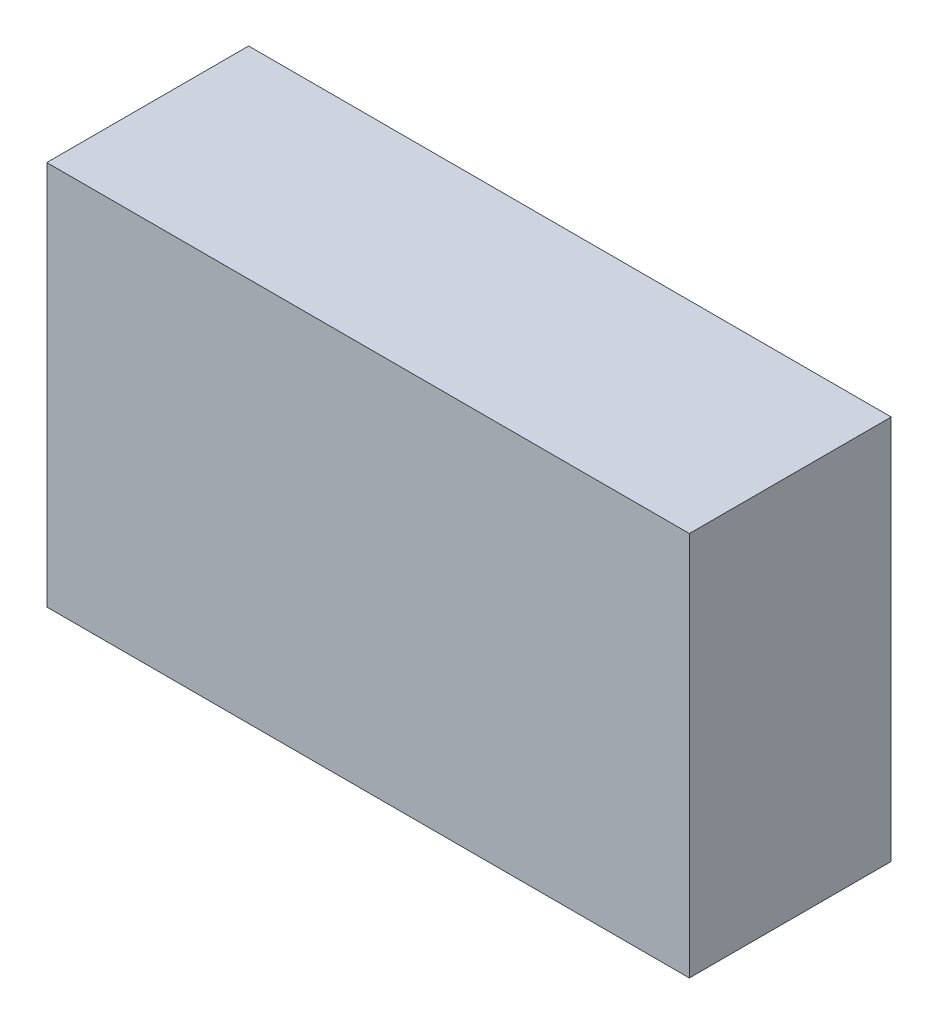
from build123d import *

# Parameters (mm, degrees)
SKETCH1_W           = 161.724310644
SKETCH1_H           = 96.872862076
BOSS_EXTRUDE1_DEPTH = 50.8


with BuildPart() as part:
    # Sketch1 → Boss-Extrude1 (new body)
    with BuildSketch(Plane.XY):
        Rectangle(SKETCH1_W, SKETCH1_H)
    extrude(amount=BOSS_EXTRUDE1_DEPTH)


solid = part.part
